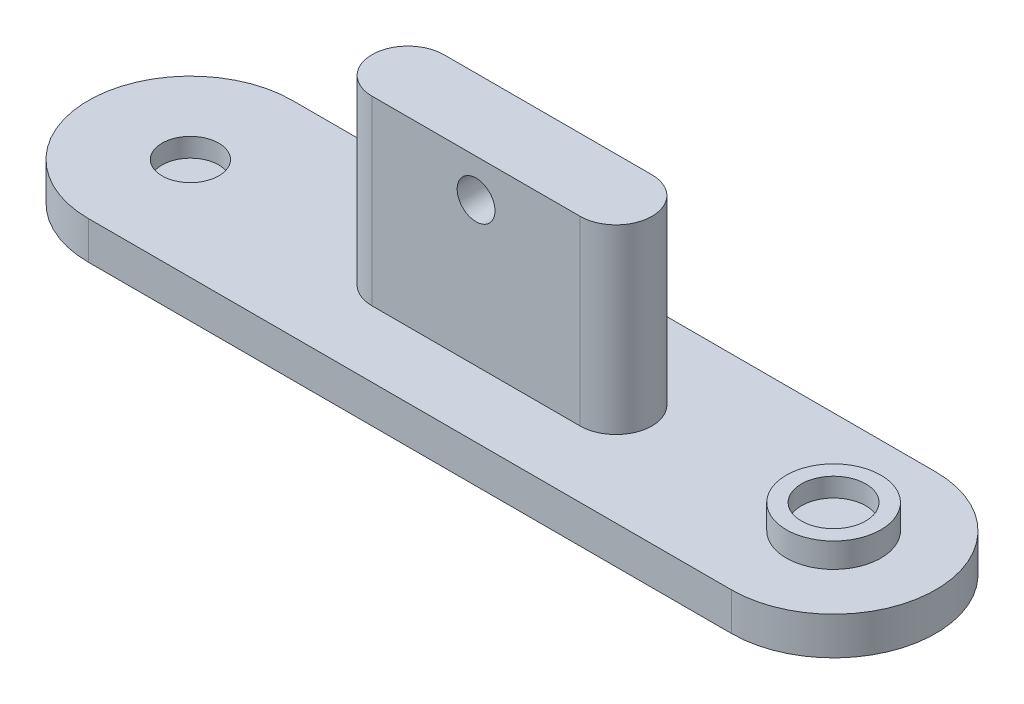
from build123d import *

# Parameters (mm, degrees)
BOSS_EXTRUDE1_DEPTH = 5
SKETCH2_R           = 3.75
CUT_EXTRUDE1_DEPTH  = 2.5
SKETCH3_R           = 6.25
BOSS_EXTRUDE3_DEPTH = 3.25
SKETCH4_R           = 4.25
CUT_EXTRUDE2_DEPTH  = 2.5
BOSS_EXTRUDE4_DEPTH = 24
SKETCH6_R           = 2.5
CUT_EXTRUDE3_DEPTH  = 66.651066252


with BuildPart() as part:
    # Sketch1 → Boss-Extrude1 (new body)
    with BuildSketch(Plane(origin=(0, 0, 0), x_dir=(1, 0, 0), z_dir=(0, 1, 0))):
        with BuildLine():
            Line((-42.5, -13.5), (42.5, -13.5))
            ThreePointArc((42.5, -13.5), (56, 0), (42.5, 13.5))
            Line((42.5, 13.5), (-42.5, 13.5))
            ThreePointArc((-42.5, 13.5), (-56, 0), (-42.5, -13.5))
        make_face()
    extrude(amount=BOSS_EXTRUDE1_DEPTH)

    # Sketch2 → Cut-Extrude1 (cut)
    with BuildSketch(Plane(origin=(0, 5, 0), x_dir=(1, 0, 0), z_dir=(0, 1, 0))):
        with Locations((-42.5, 0)):
            Circle(SKETCH2_R)
    extrude(amount=-CUT_EXTRUDE1_DEPTH, mode=Mode.SUBTRACT)

    # Sketch3 → Boss-Extrude3 (add)
    with BuildSketch(Plane(origin=(0, 5, 0), x_dir=(1, 0, 0), z_dir=(0, 1, 0))):
        with Locations((42.5, 0)):
            Circle(SKETCH3_R)
    extrude(amount=BOSS_EXTRUDE3_DEPTH)

    # Sketch4 → Cut-Extrude2 (cut)
    with BuildSketch(Plane(origin=(0, 8.25, 0), x_dir=(1, 0, 0), z_dir=(0, 1, 0))):
        with Locations((42.5, 0)):
            Circle(SKETCH4_R)
    extrude(amount=-CUT_EXTRUDE2_DEPTH, mode=Mode.SUBTRACT)

    # Sketch5 → Boss-Extrude4 (add)
    with BuildSketch(Plane(origin=(0, 5, 0), x_dir=(1, 0, 0), z_dir=(0, 1, 0))):
        with BuildLine():
            Line((-13.75, 4.75), (13.75, 4.75))
            ThreePointArc((13.75, 4.75), (18.5, 0), (13.75, -4.75))
            Line((13.75, -4.75), (-13.75, -4.75))
            ThreePointArc((-13.75, -4.75), (-18.5, 0), (-13.75, 4.75))
        make_face()
    extrude(amount=BOSS_EXTRUDE4_DEPTH)

    # Sketch6 → Cut-Extrude3 (cut, through all)
    with BuildSketch(Plane(origin=(0, 0, -4.75), x_dir=(-1, 0, 0), z_dir=(0, 0, -1))):
        with Locations((0, 24)):
            Circle(SKETCH6_R)
    extrude(amount=-CUT_EXTRUDE3_DEPTH, mode=Mode.SUBTRACT)


solid = part.part
